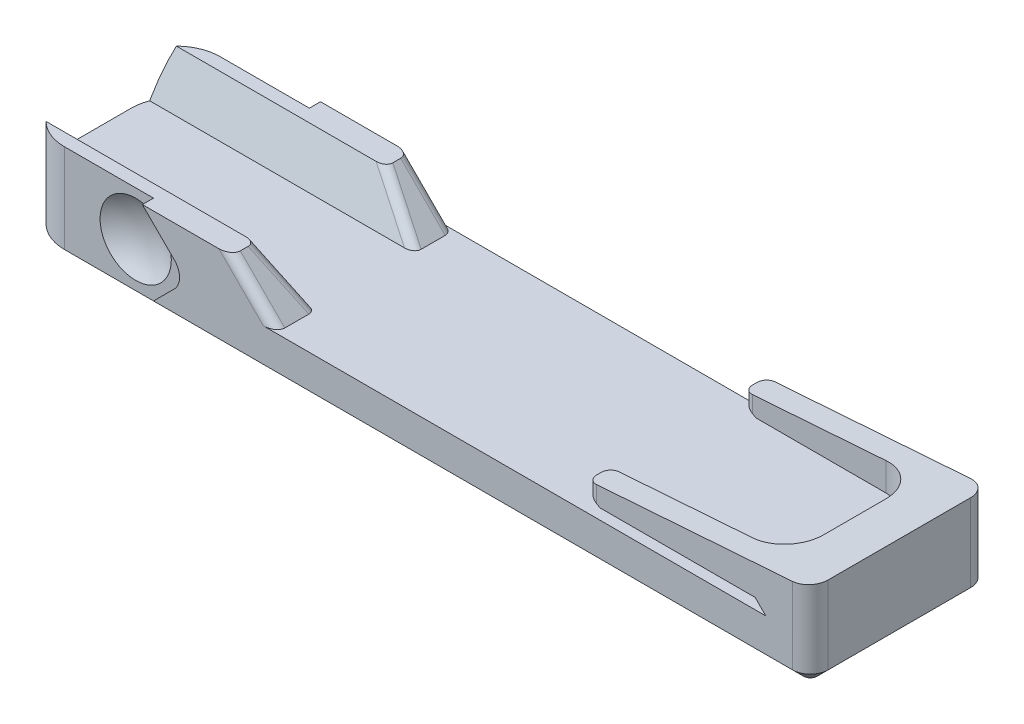
from build123d import *

# Parameters (mm, degrees)
BOSS_EXTRUDE1_DEPTH = 12.7
SKETCH2_W           = 19.05
SKETCH2_H           = 6.35
CUT_EXTRUDE1_DEPTH  = 107.95
CUT_EXTRUDE2_DEPTH  = 64.816710194
CHAMFER1_SIZE       = 6.978592645
CHAMFER1_SIZE_2     = 2.54
CUT_EXTRUDE3_DEPTH  = 1.5875
CHAMFER3_SIZE       = 1.5875
FILLET1_R           = 6.35
FILLET2_R           = 1.27
FILLET3_R           = 5.08
CHAMFER4_SIZE       = 1.524


# Some blends are built 0.0001 mm under size
with BuildPart() as part:
    # Sketch1 → Boss-Extrude1 (new body)
    with BuildSketch(Plane(origin=(0, 0, 0), x_dir=(1, 0, 0), z_dir=(0, 1, 0))):
        with BuildLine():
            Line((-50.8, 12.7), (-57.15, 12.7))
            Line((-57.15, 12.7), (-57.15, 6.35))
            Line((-57.15, 6.35), (-57.15, -6.35))
            Line((-57.15, -6.35), (-57.15, -12.7))
            Line((-57.15, -12.7), (-50.8, -12.7))
            Line((-50.8, -12.7), (54.61, -12.7))
            ThreePointArc((54.61, -12.7), (56.406051224, -11.956051224), (57.15, -10.16))
            Line((57.15, -10.16), (57.15, 10.16))
            ThreePointArc((57.15, 10.16), (56.406051224, 11.956051224), (54.61, 12.7))
            Line((54.61, 12.7), (-50.8, 12.7))
        make_face()
    extrude(amount=BOSS_EXTRUDE1_DEPTH)

    # Sketch2 → Cut-Extrude1 (cut)
    with BuildSketch(Plane.ZY.offset(57.15)):
        with Locations((0, 9.525)):
            Rectangle(SKETCH2_W, SKETCH2_H)
    extrude(amount=-CUT_EXTRUDE1_DEPTH, mode=Mode.SUBTRACT)

    # Sketch3 → Cut-Extrude2 (cut, through all)
    with BuildSketch(Plane.XY.offset(12.7)):
        Polygon((25.4, 10.414), (57.15, 12.7), (-25.4, 12.7), (-19.05, 6.35), (50.8, 6.35), (50.8, 7.874), (27.15976362, 7.874), (25.4, 8.89), align=None)
    extrude(amount=-CUT_EXTRUDE2_DEPTH, mode=Mode.SUBTRACT)

    # Chamfer1
    # the kernel refuses this chamfer: 6.978592645, 2.54 mm, written as the material it adds along each edge
    with BuildSketch(Plane(origin=(-57.15, 6.35, 9.525), x_dir=(0, 0.9999130865277316, 0.013184058198642549), z_dir=(1, 0, 0))) as chamfer1_piece_1_section:
        Polygon((CHAMFER1_SIZE * 0.999913086587, -CHAMFER1_SIZE * 0.0131840581994), (-CHAMFER1_SIZE_2 * 0.0131840581987, -CHAMFER1_SIZE_2 * 0.999913086528), (0, 0), align=None)
    chamfer1_piece_1 = extrude(amount=56.203828281, mode=Mode.PRIVATE)
    chamfer1_piece_1 = split(chamfer1_piece_1, bisect_by=Plane(origin=(-39.199121236, 12.7, 8.706690515), z_dir=(0, -1, 0)), keep=Keep.TOP, mode=Mode.PRIVATE)
    chamfer1_piece_1 = split(chamfer1_piece_1, bisect_by=Plane(origin=(-30.223681853, 17.523681853, 8.706690515), z_dir=(-0.7071067811865448, -0.7071067811865503, 0)), keep=Keep.TOP, mode=Mode.PRIVATE)
    add(chamfer1_piece_1)
    with BuildSketch(Plane(origin=(-57.15, 6.35, -9.525), x_dir=(0, -0.09904090225207035, 0.9950833631817466), z_dir=(1, 0, 0))) as chamfer1_piece_2_section:
        Polygon((CHAMFER1_SIZE_2 * 0.995083363182, -CHAMFER1_SIZE_2 * 0.099040902252), (-CHAMFER1_SIZE * 0.099040902258, -CHAMFER1_SIZE * 0.995083363241), (0, 0), align=None)
    chamfer1_piece_2 = extrude(amount=56.203828281, mode=Mode.PRIVATE)
    chamfer1_piece_2 = split(chamfer1_piece_2, bisect_by=Plane(origin=(-30.223681853, 17.523681853, -8.706690515), z_dir=(-0.7071067811865448, -0.7071067811865503, 0)), keep=Keep.TOP, mode=Mode.PRIVATE)
    chamfer1_piece_2 = split(chamfer1_piece_2, bisect_by=Plane(origin=(-39.199121236, 12.7, -8.706690515), z_dir=(0, -1, 0)), keep=Keep.TOP, mode=Mode.PRIVATE)
    add(chamfer1_piece_2)

    # Sketch4 → Cut-Extrude3 (cut)
    with BuildSketch(Plane.XY.offset(12.7)):
        with BuildLine():
            Line((-57.15, 12.7), (-57.15, 0))
            Line((-57.15, 0), (-38.1, 0))
            Line((-38.1, 0), (-33.546051224, 4.553948776))
            ThreePointArc((-33.546051224, 4.553948776), (-32.802102448, 6.35), (-33.546051224, 8.146051224))
            Line((-33.546051224, 8.146051224), (-38.1, 12.7))
            Line((-38.1, 12.7), (-57.15, 12.7))
        make_face()
    cut_extrude3 = extrude(amount=-CUT_EXTRUDE3_DEPTH, mode=Mode.SUBTRACT)

    # Sketch6 → Cut-Revolve1 (revolve, cut)
    with BuildSketch(Plane.ZY.offset(40.64)):
        with BuildLine():
            Line((11.1125, 6.35), (11.1125, 11.43))
            ThreePointArc((11.1125, 11.43), (9.931118256, 9.01113492), (9.525, 6.35))
            Line((9.525, 6.35), (11.1125, 6.35))
        make_face()
    cut_revolve1 = revolve(axis=Axis((-40.64, 6.35, 12.7), (0, 0, -1)), mode=Mode.SUBTRACT)

    # Mirror1: Cut-Extrude3, Cut-Revolve1 across plane
    add(cut_extrude3.mirror(Plane(origin=(0, 0, 0), x_dir=(1, 0, 0), z_dir=(0, 0, -1))), mode=Mode.SUBTRACT)
    add(cut_revolve1.mirror(Plane(origin=(0, 0, 0), x_dir=(1, 0, 0), z_dir=(0, 0, -1))), mode=Mode.SUBTRACT)

    # Chamfer3
    chamfer3_edges = [part.edges().sort_by_distance(p)[0] for p in [
        (8.255, 0, 12.7),
        (56.406051224, 0, 11.956051224),
        (57.15, 0, 0),
        (56.406051224, 0, -11.956051224),
        (8.255, 0, -12.7),
    ]]
    chamfer(chamfer3_edges, length=CHAMFER3_SIZE)

    # Fillet1
    fillet1_edges = [part.edges().sort_by_distance(p)[0] for p in [
        (-57.15, 6.35, -11.1125),
        (-57.15, 6.35, 11.1125),
    ]]
    fillet(fillet1_edges, radius=FILLET1_R)

    # Fillet2
    fillet2_edges = [part.edges().sort_by_distance(p)[0] for p in [
        (-22.225, 9.525, 8.140605494),
        (-22.225, 9.525, -8.140605494),
        (25.4, 9.652, -9.525),
        (-22.225, 9.525, 12.7),
        (25.4, 9.652, 12.7),
        (25.4, 9.652, 9.525),
        (25.4, 9.652, -12.7),
        (-22.225, 9.525, -12.7),
    ]]
    fillet(fillet2_edges, radius=FILLET2_R)

    # Fillet3
    fillet3_edges = [part.edges().sort_by_distance(p)[0] for p in [
        (50.8, 10.0584, -9.525),
        (50.8, 10.0584, 9.525),
    ]]
    fillet(fillet3_edges, radius=FILLET3_R)

    # Chamfer4
    chamfer4_edges = [part.edges().sort_by_distance(p)[0] for p in [
        (50.8, 7.874, -8.5725),
        (50.8, 7.874, 8.5725),
    ]]
    chamfer(chamfer4_edges, length=CHAMFER4_SIZE - 0.0001)  # a hair under: the kernel refuses the full size


solid = part.part
